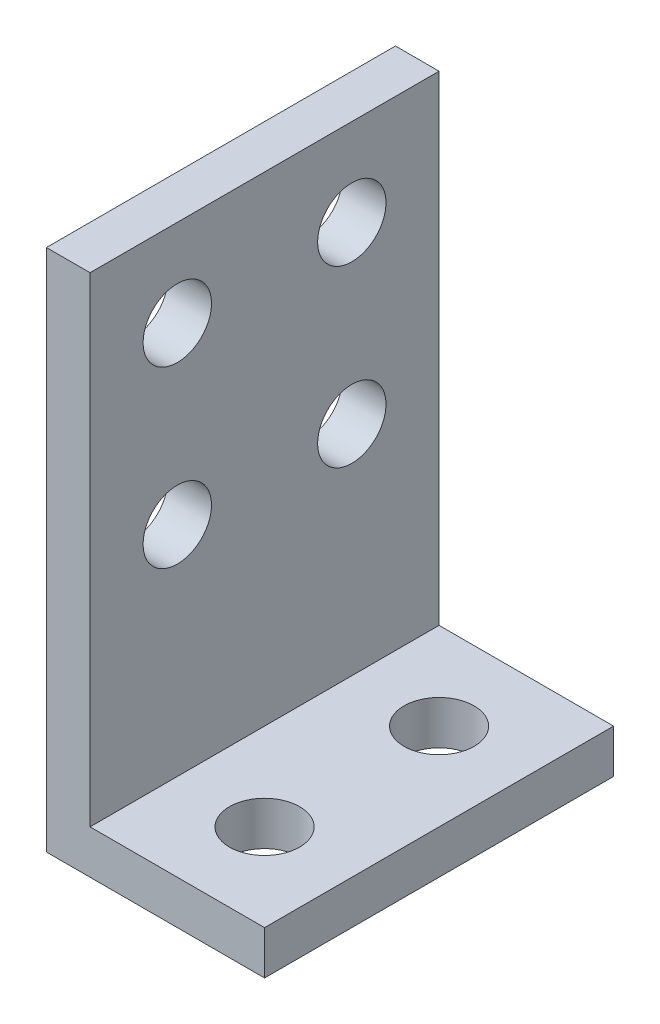
from build123d import *

# Parameters (mm, degrees)
BOSS_EXTRUDE1_DEPTH = 25.4
SKETCH2_R           = 2.5527
CUT_EXTRUDE1_DEPTH  = 47.010121169
SKETCH4_R           = 2.4892
CUT_EXTRUDE2_DEPTH  = 49.464271634


with BuildPart() as part:
    # Sketch1 → Boss-Extrude1 (new body)
    with BuildSketch(Plane.XY):
        Polygon((0, 0), (0, 38.1), (3.175, 38.1), (3.175, 3.175), (15.875, 3.175), (15.875, 0), align=None)
    extrude(amount=BOSS_EXTRUDE1_DEPTH)

    # Sketch2 → Cut-Extrude1 (cut, through all)
    with BuildSketch(Plane(origin=(0, 3.175, 0), x_dir=(1, 0, 0), z_dir=(0, 1, 0))):
        with Locations((9.525, -6.35)):
            Circle(SKETCH2_R)
        with Locations((9.525, -19.05)):
            Circle(SKETCH2_R)
    extrude(amount=-CUT_EXTRUDE1_DEPTH, mode=Mode.SUBTRACT)

    # Sketch4 → Cut-Extrude2 (cut, through all)
    with BuildSketch(Plane.ZY):
        with Locations((6.35, 31.75)):
            Circle(SKETCH4_R)
        with Locations((19.05, 31.75)):
            Circle(SKETCH4_R)
        with Locations((19.05, 19.05)):
            Circle(SKETCH4_R)
        with Locations((6.35, 19.05)):
            Circle(SKETCH4_R)
    extrude(amount=-CUT_EXTRUDE2_DEPTH, mode=Mode.SUBTRACT)


solid = part.part
